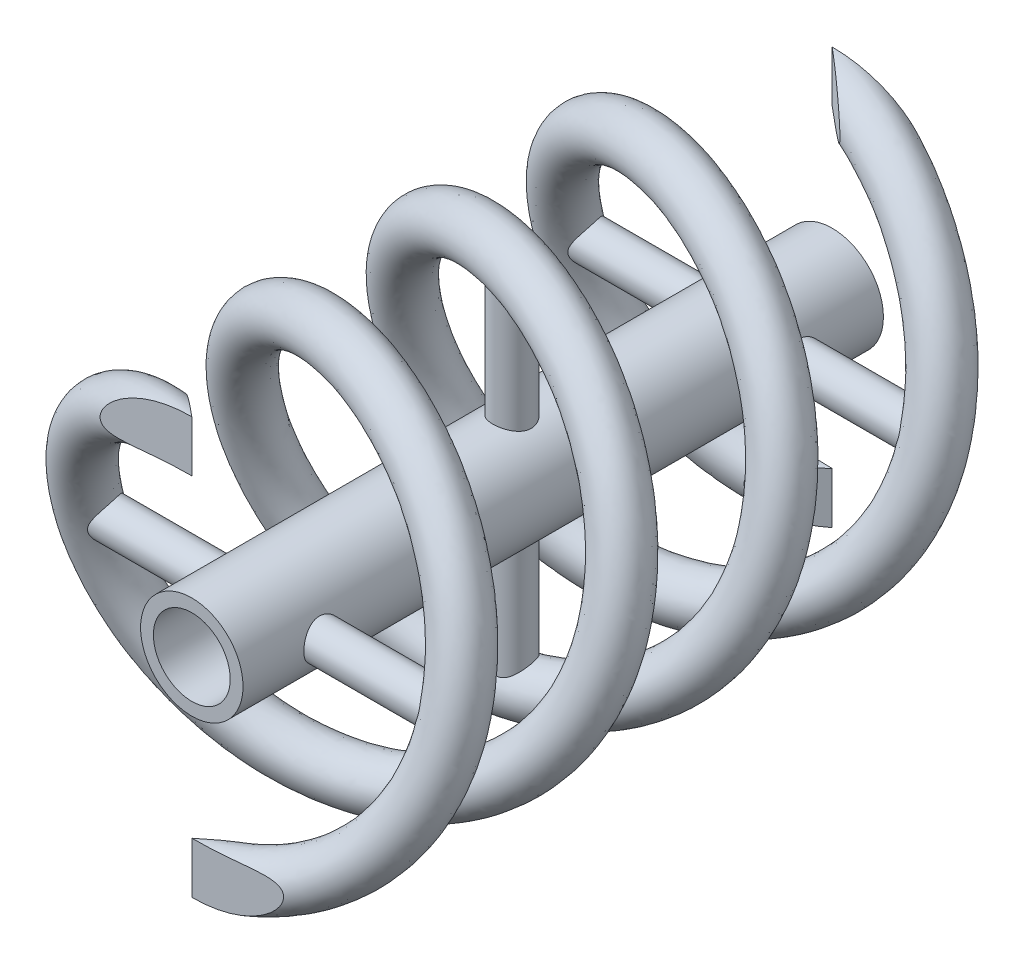
from build123d import *

# Parameters (mm, degrees)
SWEEP1_PITCH            = 5
SWEEP1_HEIGHT           = 10
SWEEP1_RADIUS           = 2.85
SWEEP1_START_ANGLE      = 90
SWEEP1_PROFILE_R        = 0.4
BODY_MOVE_COPY1_ANGLE   = 180
SKETCH13_R              = 0.8
BOSS_EXTRUDE3_DEPTH     = 10
SKETCH26_R              = 0.3
BOSS_EXTRUDE5_DEPTH     = 3
SKETCH31_R              = 0.3
BOSS_EXTRUDE6_DEPTH     = 3
CUT_EXTRUDE1_DEPTH      = 12.356879079
CUT_EXTRUDE1_DEPTH_BACK = 12.356879079
CUT_EXTRUDE2_DEPTH      = 12.356879079
CUT_EXTRUDE2_DEPTH_BACK = 12.356879079
CUT_EXTRUDE8_DEPTH      = 13.675417274
CUT_EXTRUDE8_DEPTH_BACK = 2
CUT_EXTRUDE10_DEPTH     = 2
CUT_EXTRUDE7_DEPTH      = 12.356879079
CUT_EXTRUDE7_DEPTH_BACK = 12.356879079
SKETCH21_R              = 0.6


with BuildPart() as part:
    # Sweep1: sweep along a helix
    with BuildLine() as sweep1_path:
        add(Helix(SWEEP1_PITCH, SWEEP1_HEIGHT, SWEEP1_RADIUS, center=(0, 0, 0), direction=(0, 0, 1), lefthand=True, mode=Mode.PRIVATE).rotate(Axis((0, 0, 0), (0, 0, 1)), SWEEP1_START_ANGLE))
    # Sweep1 profile (on start of the path) → Sweep1 (sweep)
    with BuildSketch(Plane(origin=(0, 2.85, 0), x_dir=(-0.26893249196120517, 0, 0.9631590288044527), z_dir=(0.9631590288044527, 2.1760873204914477e-13, 0.26893249196120517))):
        Circle(SWEEP1_PROFILE_R)
    sweep(path=sweep1_path.line, is_frenet=True)


with BuildPart() as body_2:
    # Body-Move/Copy1: copy of part
    add(part.part.rotate(Axis((0, 0, 0), (0, 0, 1)), BODY_MOVE_COPY1_ANGLE))


with BuildPart() as body_3:
    # Sketch13 → Boss-Extrude3 (new body)
    with BuildSketch(Plane.XY):
        Circle(SKETCH13_R)
    extrude(amount=BOSS_EXTRUDE3_DEPTH)

    # Sketch26 → Boss-Extrude5 (add, symmetric)
    with BuildSketch(Plane(origin=(0, 0, 0), x_dir=(0, 0, -1), z_dir=(1, 0, 0))):
        with Locations(Location((-8.75, -1e-09, 0), (0, 0, 180))):
            Circle(SKETCH26_R)
        with Locations(Location((-1.25, -1e-09, 0), (0, 0, 180))):
            Circle(SKETCH26_R)
    extrude(amount=BOSS_EXTRUDE5_DEPTH, both=True)


with BuildPart() as part_1:
    add(part.part)

    add(body_2.part)  # Boss-Extrude6 merges body 2

    add(body_3.part)  # Boss-Extrude6 merges body 3
    # Sketch31 → Boss-Extrude6 (add, symmetric)
    with BuildSketch(Plane(origin=(0, 0, 0), x_dir=(1, 0, 0), z_dir=(0, 1, 0))):
        with Locations(Location((0, -5, 0), (0, 0, 90))):
            Circle(SKETCH31_R)
    extrude(amount=BOSS_EXTRUDE6_DEPTH, both=True)

    # Sketch14 → Cut-Extrude1 (cut, two sides: drawn at the far end of the back side and taken through both)
    with BuildSketch(Plane(origin=(0, 0, 0), x_dir=(0, 0, -1), z_dir=(1, 0, 0)).offset(-CUT_EXTRUDE1_DEPTH_BACK)):
        Polygon((-10, 0), (-10, 4.202907869), (-11.256184263, 4.202907869), (-11.256184263, -3.546615133), (-10, -3.546615133), align=None)
    extrude(amount=CUT_EXTRUDE1_DEPTH + CUT_EXTRUDE1_DEPTH_BACK, mode=Mode.SUBTRACT)

    # Sketch15 → Cut-Extrude2 (cut, two sides: drawn at the far end of the back side and taken through both)
    with BuildSketch(Plane(origin=(0, 0, 0), x_dir=(0, 0, -1), z_dir=(1, 0, 0)).offset(-CUT_EXTRUDE2_DEPTH_BACK)):
        Polygon((0, 0), (0, 4.564855858), (2.070732666, 4.564855858), (2.070732666, -3.818204791), (0, -3.818204791), align=None)
    extrude(amount=CUT_EXTRUDE2_DEPTH + CUT_EXTRUDE2_DEPTH_BACK, mode=Mode.SUBTRACT)

    # Sketch17 → Cut-Extrude8 (cut, two sides: drawn at the far end of the back side and taken through both)
    with BuildSketch(Plane(origin=(0, 3.25, 0), x_dir=(1, 0, 0), z_dir=(0, 1, 0)).offset(-CUT_EXTRUDE8_DEPTH_BACK)):
        Polygon((0, -10), (0.572109682, -10), (0.572109682, -8.804415046), (-1.424842664, -8.804415046), align=None)
        Polygon((0, 0), (-0.572109682, 0), (-0.572109682, -1.195584954), (1.424842664, -1.195584954), align=None)
    extrude(amount=CUT_EXTRUDE8_DEPTH + CUT_EXTRUDE8_DEPTH_BACK, mode=Mode.SUBTRACT)

    # Sketch19 → Cut-Extrude10 (cut)
    with BuildSketch(Plane(origin=(0, -3.25, 0), x_dir=(1, 0, 0), z_dir=(0, 1, 0))):
        Polygon((0, 0), (0.516408083, 0), (0.516408083, -1.195584954), (-1.424842664, -1.195584954), align=None)
        Polygon((0, -10), (-0.35802988, -10), (-0.373022014, -10.006696833), (-0.373022014, -8.804415046), (1.424842664, -8.804415046), align=None)
    extrude(amount=CUT_EXTRUDE10_DEPTH, mode=Mode.SUBTRACT)

    # Sketch21 → Cut-Extrude7 (cut, two sides: drawn at the far end of the back side and taken through both)
    with BuildSketch(Plane.XY.offset(-CUT_EXTRUDE7_DEPTH_BACK)):
        Circle(SKETCH21_R)
    extrude(amount=CUT_EXTRUDE7_DEPTH + CUT_EXTRUDE7_DEPTH_BACK, mode=Mode.SUBTRACT)


solid = part_1.part
